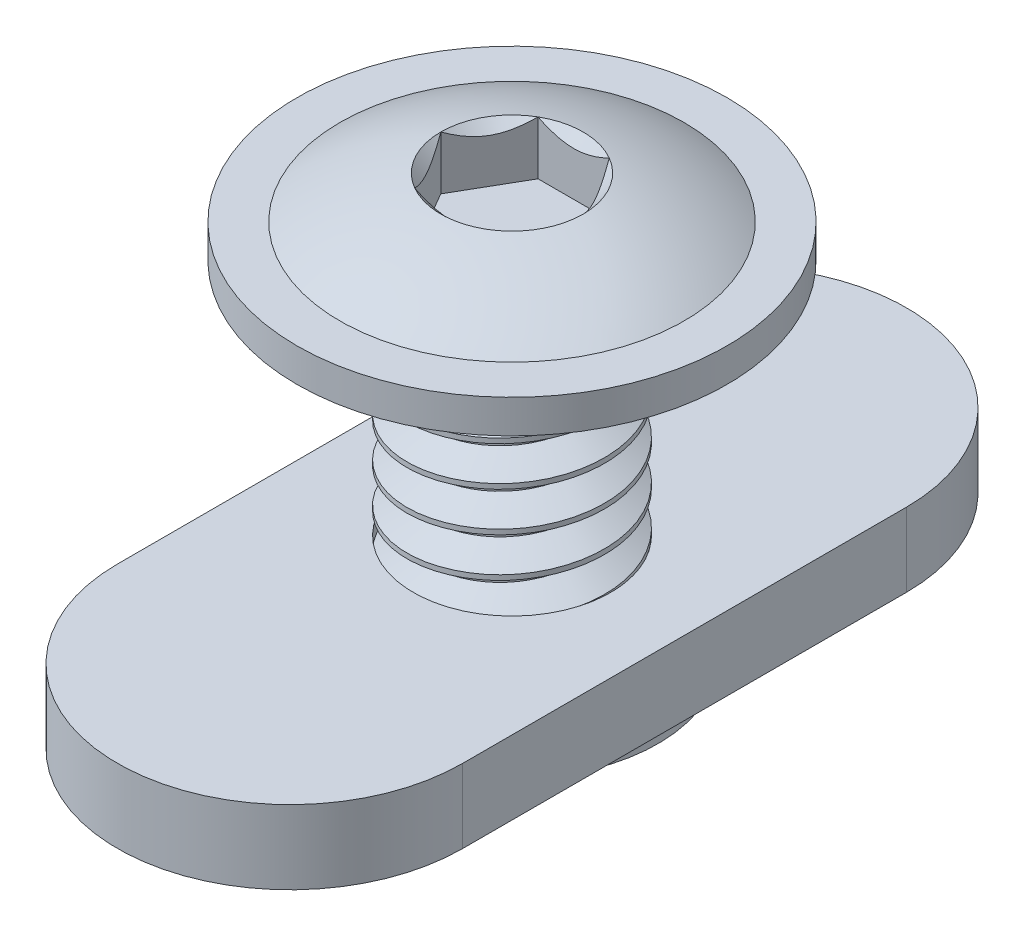
from build123d import *

# Parameters (mm, degrees)
SKETCH2_W                    = 3.175
SKETCH2_H                    = 10.16
CHAMFER1_SIZE                = 1.27
CUT_SWEEP1_PITCH             = 1.27
CUT_EXTRUDE1_DEPTH           = 1.984375
SKETCH7_R                    = 2.291358881
CUT_EXTRUDE2_DEPTH           = 1.726209
CUT_EXTRUDE2_TAPER           = 45
CUT_EXTRUDE2_OTHER_WAY_DEPTH = 16.950832279
SKETCH8_R                    = 3.175
EXTRUDE1_DEPTH               = 1.7272
SKETCH9_R                    = 4.699
CUT_EXTRUDE3_DEPTH           = 1.0795


with BuildPart() as part:
    # Sketch2 → Revolve2 (revolve)
    with BuildSketch(Plane.XY, mode=Mode.PRIVATE) as revolve2_sk:
        with Locations((-1.5875, 0)):
            Rectangle(SKETCH2_W, SKETCH2_H)
    revolve(revolve2_sk.sketch.rotate(Axis((0, 0, 0), (0, 1, 0)), 270), axis=Axis((0, 0, 0), (0, 1, 0)))

    # Chamfer1
    chamfer1_edges = [part.edges().sort_by_distance(p)[0] for p in [
        (0, -5.08, 3.175),
    ]]
    chamfer(chamfer1_edges, length=CHAMFER1_SIZE)

    # Cut-Sweep1: the profile of Sketch4 profile screwed along a right-hand helix of 11.75 turns, 6 arcs to a turn; built about Z, then put on its axis
    cut_sweep1_z = Axis((0, 0, 0), (0, 0, 1))
    cut_sweep1_corners = [(3.1753, 0, -1.111423205), (3.1753, 0, 0.000173205), (2.350110803, 0, -0.47625), (2.350110803, 0, -0.635)]
    with BuildLine(mode=Mode.PRIVATE) as cut_sweep1_profile:
        Line(cut_sweep1_corners[0], cut_sweep1_corners[1])
        Line(cut_sweep1_corners[1], cut_sweep1_corners[2])
        Line(cut_sweep1_corners[2], cut_sweep1_corners[3])
        Line(cut_sweep1_corners[3], cut_sweep1_corners[0])
    cut_sweep1_cap = Face(cut_sweep1_profile.wire())
    cut_sweep1_turn_angles = [0, 30, 60, 90, 120, 150, 180, 210, 240, 270, 300, 330, 360]
    cut_sweep1_turn_weights = [1, 0.8660254037844387, 1, 0.8660254037844387, 1, 0.8660254037844387, 1, 0.8660254037844387, 1, 0.8660254037844387, 1, 0.8660254037844387, 1]
    cut_sweep1_turn_rails = [Edge.make_bspline([Vector(p[0], p[1], 0).rotate(cut_sweep1_z, cut_sweep1_turn_angles[k]) / cut_sweep1_turn_weights[k] + Vector(0, 0, p[2] + CUT_SWEEP1_PITCH * cut_sweep1_turn_angles[k] / 360) for k in range(13)], [0, 0, 0, 1, 1, 2, 2, 3, 3, 4, 4, 5, 5, 6, 6, 6], 2, cut_sweep1_turn_weights) for p in cut_sweep1_corners]
    cut_sweep1_turn_sides = [Face.make_surface_from_curves(cut_sweep1_turn_rails[p[0]], cut_sweep1_turn_rails[p[1]]) for p in [(0, 1), (1, 2), (2, 3), (3, 0)]]
    cut_sweep1_last_angles = [3960, 3990, 4020, 4050, 4080, 4110, 4140, 4170, 4200, 4215, 4230]
    cut_sweep1_last_weights = [1, 0.8660254037844387, 1, 0.8660254037844387, 1, 0.8660254037844387, 1, 0.8660254037844387, 1, 0.9659258262890169, 1]
    cut_sweep1_last_rails = [Edge.make_bspline([Vector(p[0], p[1], 0).rotate(cut_sweep1_z, cut_sweep1_last_angles[k]) / cut_sweep1_last_weights[k] + Vector(0, 0, p[2] + CUT_SWEEP1_PITCH * cut_sweep1_last_angles[k] / 360) for k in range(11)], [0, 0, 0, 1, 1, 2, 2, 3, 3, 4, 4, 5, 5, 5], 2, cut_sweep1_last_weights) for p in cut_sweep1_corners]
    cut_sweep1_last_sides = [Face.make_surface_from_curves(cut_sweep1_last_rails[p[0]], cut_sweep1_last_rails[p[1]]) for p in [(0, 1), (1, 2), (2, 3), (3, 0)]]
    cut_sweep1 = Plane(origin=(0, 5.08, 0), x_dir=(1, 0, 0), z_dir=(0, -1, 0)) * Solid(Shell([*[p.moved(Location((0, 0, CUT_SWEEP1_PITCH * i))) for i in range(11) for p in cut_sweep1_turn_sides], *cut_sweep1_last_sides, cut_sweep1_cap, cut_sweep1_cap.rotate(cut_sweep1_z, 4230).moved(Location((0, 0, CUT_SWEEP1_PITCH * 4230 / 360)))]))
    add(cut_sweep1, mode=Mode.SUBTRACT)

    # Sketch5 → Revolve3 (revolve)
    with BuildSketch(Plane.XY):
        with BuildLine():
            Line((0, 5.08), (0, 7.7724))
            ThreePointArc((0, 7.7724), (-2.884017607, 7.360293811), (-5.5372, 6.15696))
            Line((-5.5372, 6.15696), (-6.9215, 6.15696))
            Line((-6.9215, 6.15696), (-6.9215, 5.08))
            Line((-6.9215, 5.08), (0, 5.08))
        make_face()
    revolve(axis=Axis((0, 0, 0), (0, 1, 0)))

    # Sketch6 → Cut-Extrude1 (cut)
    with BuildSketch(Plane(origin=(0, 7.7724, 0), x_dir=(-1, 0, 0), z_dir=(0, 1, 0))):
        Polygon((1.14567944, 1.984375), (-1.14567944, 1.984375), (-2.291358881, 0), (-1.14567944, -1.984375), (1.14567944, -1.984375), (2.291358881, 0), align=None)
    extrude(amount=-CUT_EXTRUDE1_DEPTH, mode=Mode.SUBTRACT)

    # Sketch7 → Cut-Extrude2 (cut)
    with BuildSketch(Plane(origin=(0, 7.514233625, 0), x_dir=(-1, 0, 0), z_dir=(0, 1, 0))):
        Circle(SKETCH7_R)
    extrude(amount=-CUT_EXTRUDE2_DEPTH, taper=CUT_EXTRUDE2_TAPER, mode=Mode.SUBTRACT)

    # Sketch7 → Cut-Extrude2 other way (cut)
    with BuildSketch(Plane(origin=(0, 7.514233625, 0), x_dir=(-1, 0, 0), z_dir=(0, 1, 0))):
        Circle(SKETCH7_R)
    extrude(amount=CUT_EXTRUDE2_OTHER_WAY_DEPTH, mode=Mode.SUBTRACT)


with BuildPart() as body_2:
    # Sketch8 → Extrude1 (new, symmetric)
    with BuildSketch(Plane.XZ.offset(4.318)):
        with BuildLine():
            Line((-5.55625, 7.14375), (-5.55625, -7.14375))
            ThreePointArc((-5.55625, -7.14375), (0, -12.7), (5.55625, -7.14375))
            Line((5.55625, -7.14375), (5.55625, 7.14375))
            ThreePointArc((5.55625, 7.14375), (0, 12.7), (-5.55625, 7.14375))
        make_face()
        with Locations(Location((0, 0, 0), (0, 0, 270))):
            Circle(SKETCH8_R, mode=Mode.SUBTRACT)
    extrude(amount=EXTRUDE1_DEPTH, both=True)

    # Sketch9 → Cut-Extrude3 (cut)
    with BuildSketch(Plane.XZ.offset(6.0452)):
        with BuildLine():
            Line((5.55625, -7.14375), (5.55625, 7.14375))
            ThreePointArc((5.55625, 7.14375), (0, 12.7), (-5.55625, 7.14375))
            Line((-5.55625, 7.14375), (-5.55625, -7.14375))
            ThreePointArc((-5.55625, -7.14375), (0, -12.7), (5.55625, -7.14375))
        make_face()
        with Locations(Location((0, 0, 0), (0, 0, 270))):
            Circle(SKETCH9_R, mode=Mode.SUBTRACT)
    extrude(amount=-CUT_EXTRUDE3_DEPTH, mode=Mode.SUBTRACT)


solid = Compound([part.part, body_2.part])
